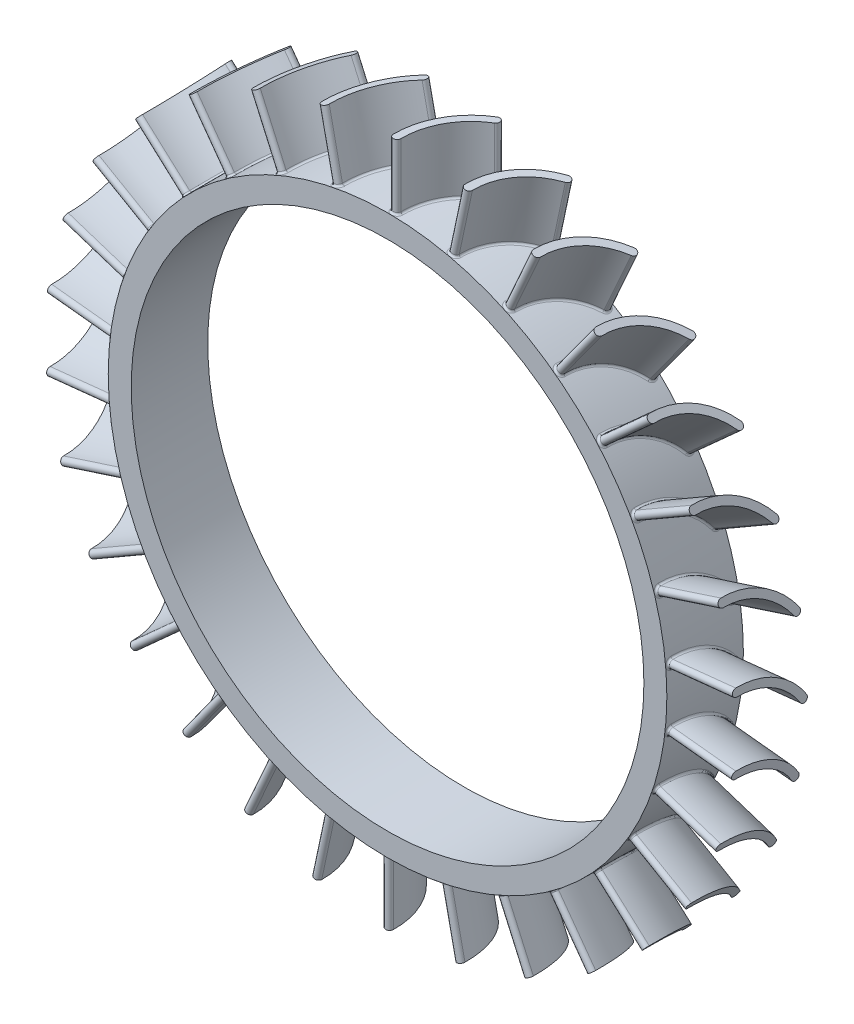
from build123d import *

# Parameters (mm, degrees)
SKETCH1_R                = 73
SKETCH1_R_2              = 67
BOSS_EXTRUDE1_DEPTH      = 10
BOSS_EXTRUDE2_START      = 68
BOSS_EXTRUDE2_DEPTH      = 22
FILLET1_R                = 0.5
CIRPATTERN1_COUNT        = 30
FILLET1_OF_CIRPATTERN1_R = 0.5


with BuildPart() as part:
    # Sketch1 → Boss-Extrude1 (new, symmetric)
    with BuildSketch(Plane.XY):
        Circle(SKETCH1_R)
        Circle(SKETCH1_R_2, mode=Mode.SUBTRACT)
    extrude(amount=BOSS_EXTRUDE1_DEPTH, both=True)

    # Sketch2 → Boss-Extrude2 (add)
    with BuildSketch(Plane(origin=(0, 0, 0), x_dir=(1, 0, 0), z_dir=(0, 1, 0)).offset(BOSS_EXTRUDE2_START)):
        with BuildLine():
            ThreePointArc((-0.015411203, -8.5), (2.48026862, 1.546814045), (9.664759511, 9))
            ThreePointArc((9.664759511, 9), (11.037278052, 8.659129273), (10.696407325, 7.286610731))
            ThreePointArc((10.696407325, 7.286610731), (4.230365523, 0.578743372), (1.984253683, -8.463389269))
            ThreePointArc((1.984253683, -8.463389269), (1.002726606, -9.481527077), (-0.015411203, -8.5))
        make_face()
    boss_extrude2 = extrude(amount=BOSS_EXTRUDE2_DEPTH)

    # Fillet1
    fillet1_edges = [part.edges().sort_by_distance(p)[0] for p in [
        (2.485414926, 72.957677557, -1.556111808),
        (2.485414926, 72.957677557, -1.556111808),
        (4.2367874, 72.876948583, -0.59034287),
        (1.002786497, 72.993112136, 9.481525977),
    ]]
    fillet(fillet1_edges, radius=FILLET1_R)

    # CirPattern1: Boss-Extrude2 ×30 about axis
    cirpattern1_axis = Axis((0, 0, 10), (0, 0, -1))
    for i in range(1, CIRPATTERN1_COUNT):
        add(boss_extrude2.rotate(cirpattern1_axis, i * 360 / CIRPATTERN1_COUNT))

    # Fillet1 of CirPattern1
    fillet1_of_cirpattern1_edges = [part.edges().sort_by_distance(p)[0] for p in [
        (17.599856746, 70.846630438, -1.556111808),
        (17.599856746, 70.846630438, -1.556111808),
        (19.296173031, 70.403534774, -0.59034287),
        (16.156994568, 71.18954647, 9.481525977),
        (31.945100372, 65.639245609, -1.556111808),
        (31.945100372, 65.639245609, -1.556111808),
        (33.512223308, 64.853148661, -0.59034287),
        (30.605064447, 66.274656017, 9.481525977),
        (44.894189823, 57.563110774, -1.556111808),
        (44.894189823, 57.563110774, -1.556111808),
        (46.263628617, 56.468368751, -0.59034287),
        (43.71554615, 58.463245076, 9.481525977),
        (55.881187752, 46.971191781, -1.556111808),
        (55.881187752, 46.971191781, -1.556111808),
        (56.993091358, 45.615650162, -0.59034287),
        (54.915448716, 48.096709787, 9.481525977),
        (64.425909628, 34.326406314, -1.556111808),
        (64.425909628, 34.326406314, -1.556111808),
        (65.231682523, 32.769308773, -0.59034287),
        (63.71528266, 35.628117487, 9.481525977),
        (70.154910104, 20.181392174, -1.556111808),
        (70.154910104, 20.181392174, -1.556111808),
        (70.619336146, 18.490791346, -0.59034287),
        (69.730453011, 21.60240549, 9.481525977),
        (72.817804368, 5.154354356, -1.556111808),
        (72.817804368, 5.154354356, -1.556111808),
        (72.92058591, 3.404137608, -0.59034287),
        (72.698067962, 6.632564713, 9.481525977),
        (72.298211163, -10.097953481, -1.556111808),
        (72.298211163, -10.097953481, -1.556111808),
        (72.034856158, -11.831293278, -0.59034287),
        (72.488428499, -8.627150968, 9.481525977),
        (68.618839204, -24.908932296, -1.556111808),
        (68.618839204, -24.908932296, -1.556111808),
        (68.00085753, -26.549639875, -0.59034287),
        (69.110696872, -23.509818755, 9.481525977),
        (61.940494702, -38.631271243, -1.556111808),
        (61.940494702, -38.631271243, -1.556111808),
        (60.994895124, -40.10763981, -0.59034287),
        (62.712496163, -37.364994649, 9.481525977),
        (52.555053359, -50.665238264, -1.556111808),
        (52.555053359, -50.665238264, -1.556111808),
        (51.323163115, -51.912743428, -0.59034287),
        (53.573458443, -49.58714098, 9.481525977),
        (40.872703996, -60.484891253, -1.556111808),
        (40.872703996, -60.484891253, -1.556111808),
        (39.408362602, -61.449011053, -0.59034287),
        (42.093003515, -59.642091305, 9.481525977),
        (27.40402134, -67.661064256, -1.556111808),
        (27.40402134, -67.661064256, -1.556111808),
        (25.771227541, -68.299662029, -0.59034287),
        (28.772882348, -67.090396045, 9.481525977),
        (12.737651452, -71.880124077, -1.556111808),
        (12.737651452, -71.880124077, -1.556111808),
        (11.007766172, -72.165290037, -0.59034287),
        (14.195248156, -71.606528542, 9.481525977),
        (-2.485414926, -72.957677557, -1.556111808),
        (-2.485414926, -72.957677557, -1.556111808),
        (-4.2367874, -72.876948583, -0.59034287),
        (-1.002786497, -72.993112136, 9.481525977),
        (-17.599856746, -70.846630438, -1.556111808),
        (-17.599856746, -70.846630438, -1.556111808),
        (-19.296173031, -70.403534774, -0.59034287),
        (-16.156994568, -71.18954647, 9.481525977),
        (-31.945100372, -65.639245609, -1.556111808),
        (-31.945100372, -65.639245609, -1.556111808),
        (-33.512223308, -64.853148661, -0.59034287),
        (-30.605064447, -66.274656017, 9.481525977),
        (-44.894189823, -57.563110774, -1.556111808),
        (-44.894189823, -57.563110774, -1.556111808),
        (-46.263628617, -56.468368751, -0.59034287),
        (-43.71554615, -58.463245076, 9.481525977),
        (-55.881187752, -46.971191781, -1.556111808),
        (-55.881187752, -46.971191781, -1.556111808),
        (-56.993091358, -45.615650162, -0.59034287),
        (-54.915448716, -48.096709787, 9.481525977),
        (-64.425909628, -34.326406314, -1.556111808),
        (-64.425909628, -34.326406314, -1.556111808),
        (-65.231682523, -32.769308773, -0.59034287),
        (-63.71528266, -35.628117487, 9.481525977),
        (-70.154910104, -20.181392174, -1.556111808),
        (-70.154910104, -20.181392174, -1.556111808),
        (-70.619336146, -18.490791346, -0.59034287),
        (-69.730453011, -21.60240549, 9.481525977),
        (-72.817804368, -5.154354356, -1.556111808),
        (-72.817804368, -5.154354356, -1.556111808),
        (-72.92058591, -3.404137608, -0.59034287),
        (-72.698067962, -6.632564713, 9.481525977),
        (-72.298211163, 10.097953481, -1.556111808),
        (-72.298211163, 10.097953481, -1.556111808),
        (-72.034856158, 11.831293278, -0.59034287),
        (-72.488428499, 8.627150968, 9.481525977),
        (-68.618839204, 24.908932296, -1.556111808),
        (-68.618839204, 24.908932296, -1.556111808),
        (-68.00085753, 26.549639875, -0.59034287),
        (-69.110696872, 23.509818755, 9.481525977),
        (-61.940494702, 38.631271243, -1.556111808),
        (-61.940494702, 38.631271243, -1.556111808),
        (-60.994895124, 40.10763981, -0.59034287),
        (-62.712496163, 37.364994649, 9.481525977),
        (-52.555053359, 50.665238264, -1.556111808),
        (-52.555053359, 50.665238264, -1.556111808),
        (-51.323163115, 51.912743428, -0.59034287),
        (-53.573458443, 49.58714098, 9.481525977),
        (-40.872703996, 60.484891253, -1.556111808),
        (-40.872703996, 60.484891253, -1.556111808),
        (-39.408362602, 61.449011053, -0.59034287),
        (-42.093003515, 59.642091305, 9.481525977),
        (-27.40402134, 67.661064256, -1.556111808),
        (-27.40402134, 67.661064256, -1.556111808),
        (-25.771227541, 68.299662029, -0.59034287),
        (-28.772882348, 67.090396045, 9.481525977),
        (-12.737651452, 71.880124077, -1.556111808),
        (-12.737651452, 71.880124077, -1.556111808),
        (-11.007766172, 72.165290037, -0.59034287),
        (-14.195248156, 71.606528542, 9.481525977),
    ]]
    fillet(fillet1_of_cirpattern1_edges, radius=FILLET1_OF_CIRPATTERN1_R)


solid = part.part
